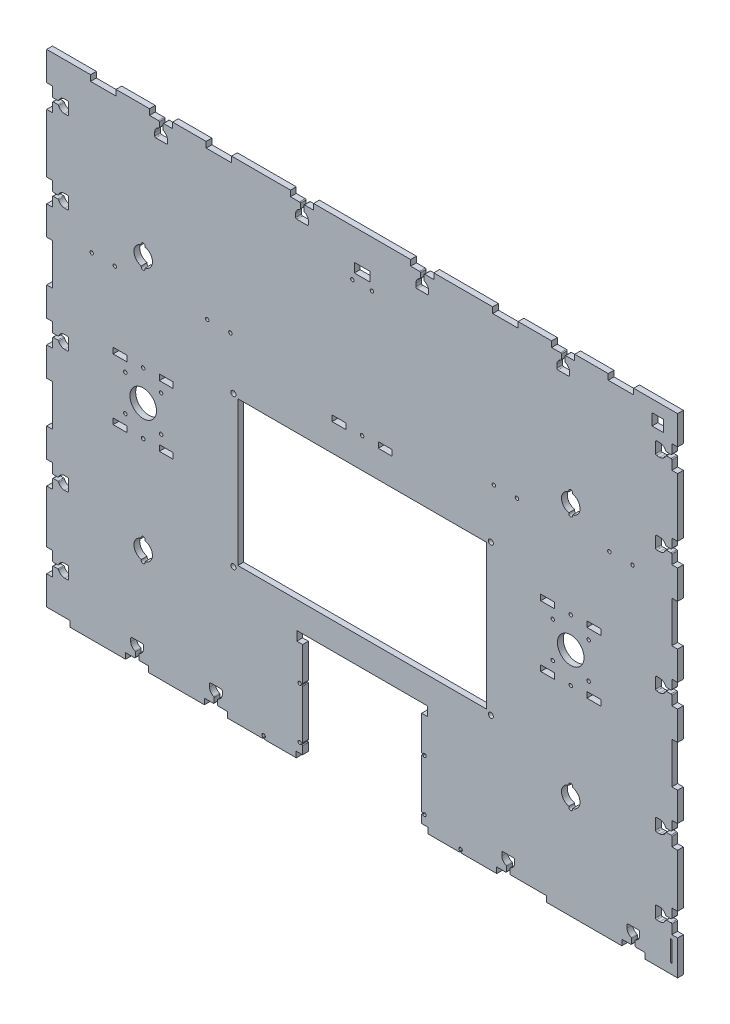
from build123d import *

# Parameters (mm, degrees)
MODEL_W             = 12
MODEL_H             = 5
MODEL_R             = 1.5
MODEL_R_2           = 11.5
MODEL_R_3           = 2.2
MODEL_W_2           = 215.000007986
MODEL_H_2           = 125.000004643
MODEL_W_3           = 1
MODEL_H_3           = 18
MODEL_R_4           = 1.500000056
MODEL_W_4           = 13.5
MODEL_H_4           = 8
MODEL_W_5           = 10
MODEL_H_5           = 10
BOSS_EXTRUDE1_DEPTH = 5


with BuildPart() as part:
    # Model → Boss-Extrude1 (new body)
    with BuildSketch(Plane.XY):
        with BuildLine():
            Line((273, -206.5), (273, -181.5))
            Line((273, -181.5), (268, -181.5))
            Line((268, -181.5), (268, -173.750193612))
            add(Edge.make_bspline(
                [(268, -173.750193612), (267.999999791, -173.33590955), (267.664103162, -173.000094081), (267.249819112, -173.000193984)],
                knots=[2, 2, 2, 2, 3, 3, 3, 3], degree=3))
            Line((267.249819112, -173.000193984), (263.325100614, -173.001131645))
            add(Edge.make_bspline(
                [(263.325100614, -173.001131645), (263.017403971, -173.001648847), (262.74197184, -173.190589935), (262.631021085, -173.477587185)],
                knots=[4, 4, 4, 4, 5, 5, 5, 5], degree=3))
            add(Edge.make_bspline(
                [(262.631021085, -173.477587185), (261.832378718, -175.533441231), (259.82894886, -177.000461264), (257.499713701, -177.0000075)],
                knots=[5, 5, 5, 5, 6, 6, 6, 6], degree=3))
            Line((257.499713701, -177.0000075), (254.900040672, -177.0000075))
            add(Edge.make_bspline(
                [(254.900040672, -177.0000075), (254.347755901, -177.0000075), (253.900040634, -176.552292233), (253.900040634, -176.000007463)],
                knots=[7, 7, 7, 7, 8, 8, 8, 8], degree=3))
            Line((253.900040634, -176.000007463), (253.900040634, -167.000007129))
            add(Edge.make_bspline(
                [(253.900040634, -167.000007129), (253.900040634, -166.447722359), (254.347755901, -166.000007092), (254.900040672, -166.000007092)],
                knots=[9, 9, 9, 9, 10, 10, 10, 10], degree=3))
            Line((254.900040672, -166.000007092), (257.499713701, -166.000007092))
            add(Edge.make_bspline(
                [(257.499713701, -166.000007092), (259.829246715, -165.99952966), (261.832905972, -167.466904671), (262.631363118, -169.52316413)],
                knots=[11, 11, 11, 11, 12, 12, 12, 12], degree=3))
            add(Edge.make_bspline(
                [(262.631363118, -169.52316413), (262.742284754, -169.810282086), (263.017801928, -169.999315929), (263.325600725, -169.999796089)],
                knots=[12, 12, 12, 12, 13, 13, 13, 13], degree=3))
            Line((263.325600725, -169.999796089), (267.249966202, -169.999974932))
            add(Edge.make_bspline(
                [(267.249966202, -169.999974932), (267.664192974, -169.999993583), (268.000000009, -169.664201661), (268, -169.249974888)],
                knots=[14, 14, 14, 14, 15, 15, 15, 15], degree=3))
            Line((268, -169.249974888), (268, -161.5))
            Line((268, -161.5), (273, -161.5))
            Line((273, -161.5), (273, -115.75))
            Line((273, -115.75), (268, -115.75))
            Line((268, -115.75), (268, -108.000193612))
            add(Edge.make_bspline(
                [(268, -108.000193612), (267.999999791, -107.58590955), (267.664103162, -107.250094081), (267.249819112, -107.250193984)],
                knots=[20, 20, 20, 20, 21, 21, 21, 21], degree=3))
            Line((267.249819112, -107.250193984), (263.325100614, -107.25113141))
            add(Edge.make_bspline(
                [(263.325100614, -107.25113141), (263.017403971, -107.251648613), (262.74197184, -107.4405897), (262.631021085, -107.727586951)],
                knots=[22, 22, 22, 22, 23, 23, 23, 23], degree=3))
            add(Edge.make_bspline(
                [(262.631021085, -107.727586951), (261.832378718, -109.783440997), (259.82894886, -111.25046103), (257.499713701, -111.250007266)],
                knots=[23, 23, 23, 23, 24, 24, 24, 24], degree=3))
            Line((257.499713701, -111.250007266), (254.900040672, -111.250007266))
            add(Edge.make_bspline(
                [(254.900040672, -111.250007266), (254.347755901, -111.250007266), (253.900040634, -110.802291999), (253.900040634, -110.250007228)],
                knots=[25, 25, 25, 25, 26, 26, 26, 26], degree=3))
            Line((253.900040634, -110.250007228), (253.900040634, -101.250006895))
            add(Edge.make_bspline(
                [(253.900040634, -101.250006895), (253.900040634, -100.697722124), (254.347755901, -100.250006858), (254.900040672, -100.250006858)],
                knots=[27, 27, 27, 27, 28, 28, 28, 28], degree=3))
            Line((254.900040672, -100.250006858), (257.499713701, -100.250006858))
            add(Edge.make_bspline(
                [(257.499713701, -100.250006858), (259.829246715, -100.249529425), (261.832905972, -101.716904437), (262.631363118, -103.773163896)],
                knots=[29, 29, 29, 29, 30, 30, 30, 30], degree=3))
            add(Edge.make_bspline(
                [(262.631363118, -103.773163896), (262.742284754, -104.060281852), (263.017801928, -104.249315695), (263.325600725, -104.249795854)],
                knots=[30, 30, 30, 30, 31, 31, 31, 31], degree=3))
            Line((263.325600725, -104.249795854), (267.249966202, -104.249974932))
            add(Edge.make_bspline(
                [(267.249966202, -104.249974932), (267.664192974, -104.249993583), (268.000000009, -103.914201661), (268, -103.499974888)],
                knots=[32, 32, 32, 32, 33, 33, 33, 33], degree=3))
            Line((268, -103.499974888), (268, -95.75))
            Line((268, -95.75), (273, -95.75))
            Line((273, -95.75), (273, -70.75))
            Line((273, -70.75), (268, -70.75))
            Line((268, -70.75), (268, -35))
            Line((268, -35), (273, -35))
            Line((273, -35), (273, -10))
            Line((273, -10), (268, -10))
            Line((268, -10), (268, -2.250193612))
            add(Edge.make_bspline(
                [(268, -2.250193612), (267.999999792, -1.83590955), (267.664103164, -1.50009408), (267.249819114, -1.500193983)],
                knots=[42, 42, 42, 42, 43, 43, 43, 43], degree=3))
            Line((267.249819114, -1.500193983), (263.325100614, -1.501124582))
            add(Edge.make_bspline(
                [(263.325100614, -1.501124582), (263.017403971, -1.501641784), (262.74197184, -1.690582872), (262.631021085, -1.977580122)],
                knots=[44, 44, 44, 44, 45, 45, 45, 45], degree=3))
            add(Edge.make_bspline(
                [(262.631021085, -1.977580122), (261.832378718, -4.033434168), (259.82894886, -5.500454201), (257.499713701, -5.500000437)],
                knots=[45, 45, 45, 45, 46, 46, 46, 46], degree=3))
            Line((257.499713701, -5.500000437), (254.900040672, -5.500000437))
            add(Edge.make_bspline(
                [(254.900040672, -5.500000437), (254.347755901, -5.500000437), (253.900040634, -5.05228517), (253.900040634, -4.5000004)],
                knots=[47, 47, 47, 47, 48, 48, 48, 48], degree=3))
            Line((253.900040634, -4.5000004), (253.900040634, 4.499999934))
            add(Edge.make_bspline(
                [(253.900040634, 4.499999934), (253.900039798, 5.052284704), (254.347754387, 5.500000649), (254.900039158, 5.500001485)],
                knots=[49, 49, 49, 49, 50, 50, 50, 50], degree=3))
            Line((254.900039158, 5.500001485), (257.499712187, 5.500001485))
            add(Edge.make_bspline(
                [(257.499712187, 5.500001485), (259.829245201, 5.500478917), (261.832904458, 4.033103906), (262.631361604, 1.976844447)],
                knots=[51, 51, 51, 51, 52, 52, 52, 52], degree=3))
            add(Edge.make_bspline(
                [(262.631361604, 1.976844447), (262.74228324, 1.689726491), (263.017800414, 1.500692648), (263.325599211, 1.500212488)],
                knots=[52, 52, 52, 52, 53, 53, 53, 53], degree=3))
            Line((263.325599211, 1.500212488), (267.249964688, 1.500026582))
            add(Edge.make_bspline(
                [(267.249964688, 1.500026582), (267.66419146, 1.500007095), (267.999999173, 1.835798339), (268, 2.250025112)],
                knots=[54, 54, 54, 54, 55, 55, 55, 55], degree=3))
            Line((268, 2.250025112), (268, 10))
            Line((268, 10), (273, 10))
            Line((273, 10), (273, 35))
            Line((273, 35), (268, 35))
            Line((268, 35), (268, 70.75))
            Line((268, 70.75), (273, 70.75))
            Line((273, 70.75), (273, 95.75))
            Line((273, 95.75), (268, 95.75))
            Line((268, 95.75), (268, 103.499806388))
            add(Edge.make_bspline(
                [(268, 103.499806388), (267.999999792, 103.91409045), (267.664103164, 104.24990592), (267.249819114, 104.249806017)],
                knots=[64, 64, 64, 64, 65, 65, 65, 65], degree=3))
            Line((267.249819114, 104.249806017), (263.325100614, 104.248875687))
            add(Edge.make_bspline(
                [(263.325100614, 104.248875687), (263.017403971, 104.248358484), (262.74197184, 104.059417397), (262.631021085, 103.772420146)],
                knots=[66, 66, 66, 66, 67, 67, 67, 67], degree=3))
            add(Edge.make_bspline(
                [(262.631021085, 103.772420146), (261.832378718, 101.7165661), (259.82894886, 100.249546068), (257.499713701, 100.249999831)],
                knots=[67, 67, 67, 67, 68, 68, 68, 68], degree=3))
            Line((257.499713701, 100.249999831), (254.900040672, 100.249999831))
            add(Edge.make_bspline(
                [(254.900040672, 100.249999831), (254.347755901, 100.249999831), (253.900040634, 100.697715098), (253.900040634, 101.249999869)],
                knots=[69, 69, 69, 69, 70, 70, 70, 70], degree=3))
            Line((253.900040634, 101.249999869), (253.900040634, 110.250000202))
            add(Edge.make_bspline(
                [(253.900040634, 110.250000202), (253.900039798, 110.802284973), (254.347754387, 111.250000917), (254.900039158, 111.250001753)],
                knots=[71, 71, 71, 71, 72, 72, 72, 72], degree=3))
            Line((254.900039158, 111.250001753), (257.499712187, 111.250001753))
            add(Edge.make_bspline(
                [(257.499712187, 111.250001753), (259.829245201, 111.250479186), (261.832904458, 109.783104174), (262.631361604, 107.726844715)],
                knots=[73, 73, 73, 73, 74, 74, 74, 74], degree=3))
            add(Edge.make_bspline(
                [(262.631361604, 107.726844715), (262.74228324, 107.439726759), (263.017800414, 107.250692916), (263.325599211, 107.250212757)],
                knots=[74, 74, 74, 74, 75, 75, 75, 75], degree=3))
            Line((263.325599211, 107.250212757), (267.249964688, 107.250026582))
            add(Edge.make_bspline(
                [(267.249964688, 107.250026582), (267.66419146, 107.250007095), (267.999999173, 107.585798339), (268, 108.000025112)],
                knots=[76, 76, 76, 76, 77, 77, 77, 77], degree=3))
            Line((268, 108.000025112), (268, 115.75))
            Line((268, 115.75), (273, 115.75))
            Line((273, 115.75), (273, 166.5))
            Line((273, 166.5), (268, 166.5))
            Line((268, 166.5), (268, 174.249806388))
            add(Edge.make_bspline(
                [(268, 174.249806388), (267.999999819, 174.66409045), (267.664103212, 174.999905941), (267.249819162, 174.999806065)],
                knots=[3, 3, 3, 3, 4, 4, 4, 4], degree=3))
            Line((267.249819162, 174.999806065), (263.325100614, 174.999106171))
            add(Edge.make_bspline(
                [(263.325100614, 174.999106171), (263.017403971, 174.998588968), (262.74197184, 174.809647881), (262.631021085, 174.522650631)],
                knots=[5, 5, 5, 5, 6, 6, 6, 6], degree=3))
            add(Edge.make_bspline(
                [(262.631021085, 174.522650631), (261.832378718, 172.466796585), (259.82894886, 170.999776552), (257.499713701, 171.000230316)],
                knots=[6, 6, 6, 6, 7, 7, 7, 7], degree=3))
            Line((257.499713701, 171.000230316), (254.900040672, 171.000230316))
            add(Edge.make_bspline(
                [(254.900040672, 171.000230316), (254.347755901, 171.000230316), (253.900040634, 171.447945583), (253.900040634, 172.000230353)],
                knots=[8, 8, 8, 8, 9, 9, 9, 9], degree=3))
            Line((253.900040634, 172.000230353), (253.900040634, 181.000230687))
            add(Edge.make_bspline(
                [(253.900040634, 181.000230687), (253.900040634, 181.552515457), (254.347755901, 182.000230724), (254.900040672, 182.000230724)],
                knots=[10, 10, 10, 10, 11, 11, 11, 11], degree=3))
            Line((254.900040672, 182.000230724), (257.499713701, 182.000230724))
            add(Edge.make_bspline(
                [(257.499713701, 182.000230724), (259.829246715, 182.000708156), (261.832905972, 180.533333145), (262.631363118, 178.477073686)],
                knots=[12, 12, 12, 12, 13, 13, 13, 13], degree=3))
            add(Edge.make_bspline(
                [(262.631363118, 178.477073686), (262.742284754, 178.18995573), (263.017801928, 178.000921887), (263.325600725, 178.000441727)],
                knots=[13, 13, 13, 13, 14, 14, 14, 14], degree=3))
            Line((263.325600725, 178.000441727), (267.249966184, 178.000025086))
            add(Edge.make_bspline(
                [(267.249966184, 178.000025086), (267.664192956, 178.000006425), (267.999999999, 178.335798339), (268, 178.750025112)],
                knots=[15, 15, 15, 15, 16, 16, 16, 16], degree=3))
            Line((268, 178.750025112), (268, 186.5))
            Line((268, 186.5), (273, 186.5))
            Line((273, 186.5), (273, 211.5))
            Line((273, 211.5), (235, 211.5))
            Line((235, 211.5), (235, 206.5))
            Line((235, 206.5), (213, 206.5))
            Line((213, 206.5), (213, 211.5))
            Line((213, 211.5), (184, 211.5))
            Line((184, 211.5), (184, 206.5))
            Line((184, 206.5), (176.250193612, 206.5))
            add(Edge.make_bspline(
                [(176.250193612, 206.5), (175.83590955, 206.499999787), (175.500094085, 206.164103154), (175.500193992, 205.749819104)],
                knots=[7, 7, 7, 7, 8, 8, 8, 8], degree=3))
            Line((175.500193992, 205.749819104), (175.501090351, 201.825100596))
            add(Edge.make_bspline(
                [(175.501090351, 201.825100596), (175.501607554, 201.517403953), (175.690548641, 201.241971822), (175.977545891, 201.131021068)],
                knots=[9, 9, 9, 9, 10, 10, 10, 10], degree=3))
            add(Edge.make_bspline(
                [(175.977545891, 201.131021068), (178.033399938, 200.332378701), (179.500419971, 198.328948843), (179.499966207, 195.999713684)],
                knots=[10, 10, 10, 10, 11, 11, 11, 11], degree=3))
            Line((179.499966207, 195.999713684), (179.499966207, 193.400040655))
            add(Edge.make_bspline(
                [(179.499966207, 193.400040655), (179.499966207, 192.847755884), (179.052250941, 192.400040617), (178.49996617, 192.400040617)],
                knots=[12, 12, 12, 12, 13, 13, 13, 13], degree=3))
            Line((178.49996617, 192.400040617), (169.499965836, 192.400040617))
            add(Edge.make_bspline(
                [(169.499965836, 192.400040617), (168.947681066, 192.400040617), (168.499965799, 192.847755884), (168.499965799, 193.400040654)],
                knots=[14, 14, 14, 14, 15, 15, 15, 15], degree=3))
            Line((168.499965799, 193.400040654), (168.499965799, 195.999713684))
            add(Edge.make_bspline(
                [(168.499965799, 195.999713684), (168.499488367, 198.329246698), (169.966863378, 200.332905955), (172.023122837, 201.131363101)],
                knots=[16, 16, 16, 16, 17, 17, 17, 17], degree=3))
            add(Edge.make_bspline(
                [(172.023122837, 201.131363101), (172.310240792, 201.242284737), (172.499274635, 201.517801911), (172.499754795, 201.825600708)],
                knots=[17, 17, 17, 17, 18, 18, 18, 18], degree=3))
            Line((172.499754795, 201.825600708), (172.499974913, 205.749966183))
            add(Edge.make_bspline(
                [(172.499974913, 205.749966183), (172.499993575, 206.164192955), (172.164201661, 206.499999999), (171.749974888, 206.5)],
                knots=[19, 19, 19, 19, 20, 20, 20, 20], degree=3))
            Line((171.749974888, 206.5), (164, 206.5))
            Line((164, 206.5), (164, 211.5))
            Line((164, 211.5), (135, 211.5))
            Line((135, 211.5), (135, 206.5))
            Line((135, 206.5), (113, 206.5))
            Line((113, 206.5), (113, 211.5))
            Line((113, 211.5), (62, 211.5))
            Line((62, 211.5), (62, 206.5))
            Line((62, 206.5), (54.250193612, 206.5))
            add(Edge.make_bspline(
                [(54.250193612, 206.5), (53.83590955, 206.499999787), (53.500094084, 206.164103155), (53.500193991, 205.749819105)],
                knots=[29, 29, 29, 29, 30, 30, 30, 30], degree=3))
            Line((53.500193991, 205.749819105), (53.50108663, 201.825100596))
            add(Edge.make_bspline(
                [(53.50108663, 201.825100596), (53.501603833, 201.517403953), (53.69054492, 201.241971822), (53.97754217, 201.131021068)],
                knots=[31, 31, 31, 31, 32, 32, 32, 32], degree=3))
            add(Edge.make_bspline(
                [(53.97754217, 201.131021068), (56.033396216, 200.332378701), (57.50041625, 198.328948843), (57.499962486, 195.999713684)],
                knots=[32, 32, 32, 32, 33, 33, 33, 33], degree=3))
            Line((57.499962486, 195.999713684), (57.499962486, 193.400040655))
            add(Edge.make_bspline(
                [(57.499962486, 193.400040655), (57.499962486, 192.847755884), (57.05224722, 192.400040617), (56.499962449, 192.400040617)],
                knots=[34, 34, 34, 34, 35, 35, 35, 35], degree=3))
            Line((56.499962449, 192.400040617), (47.499962115, 192.400040617))
            add(Edge.make_bspline(
                [(47.499962115, 192.400040617), (46.947677345, 192.400040617), (46.499962078, 192.847755884), (46.499962078, 193.400040654)],
                knots=[36, 36, 36, 36, 37, 37, 37, 37], degree=3))
            Line((46.499962078, 193.400040654), (46.499962078, 195.999713684))
            add(Edge.make_bspline(
                [(46.499962078, 195.999713684), (46.499484646, 198.329246698), (47.966859657, 200.332905955), (50.023119116, 201.131363101)],
                knots=[38, 38, 38, 38, 39, 39, 39, 39], degree=3))
            add(Edge.make_bspline(
                [(50.023119116, 201.131363101), (50.310237071, 201.242284737), (50.499270914, 201.517801911), (50.499751074, 201.825600708)],
                knots=[39, 39, 39, 39, 40, 40, 40, 40], degree=3))
            Line((50.499751074, 201.825600708), (50.499974913, 205.749966183))
            add(Edge.make_bspline(
                [(50.499974913, 205.749966183), (50.499993575, 206.164192955), (50.164201661, 206.499999999), (49.749974888, 206.5)],
                knots=[41, 41, 41, 41, 42, 42, 42, 42], degree=3))
            Line((49.749974888, 206.5), (42, 206.5))
            Line((42, 206.5), (42, 211.5))
            Line((42, 211.5), (-42, 211.5))
            Line((-42, 211.5), (-42, 206.5))
            Line((-42, 206.5), (-49.749806388, 206.5))
            add(Edge.make_bspline(
                [(-49.749806388, 206.5), (-50.16409045, 206.499999781), (-50.49990591, 206.164103143), (-50.499805997, 205.749819093)],
                knots=[47, 47, 47, 47, 48, 48, 48, 48], degree=3))
            Line((-50.499805997, 205.749819093), (-50.498862092, 201.825100596))
            add(Edge.make_bspline(
                [(-50.498862092, 201.825100596), (-50.498344889, 201.517403953), (-50.309403802, 201.241971822), (-50.022406552, 201.131021068)],
                knots=[49, 49, 49, 49, 50, 50, 50, 50], degree=3))
            add(Edge.make_bspline(
                [(-50.022406552, 201.131021068), (-47.966552506, 200.332378701), (-46.499532472, 198.328948843), (-46.499986236, 195.999713684)],
                knots=[50, 50, 50, 50, 51, 51, 51, 51], degree=3))
            Line((-46.499986236, 195.999713684), (-46.499986236, 193.400040655))
            add(Edge.make_bspline(
                [(-46.499986236, 193.400040655), (-46.499986236, 192.847755884), (-46.947701503, 192.400040617), (-47.499986273, 192.400040617)],
                knots=[52, 52, 52, 52, 53, 53, 53, 53], degree=3))
            Line((-47.499986273, 192.400040617), (-56.499986607, 192.400040617))
            add(Edge.make_bspline(
                [(-56.499986607, 192.400040617), (-57.052271377, 192.400040617), (-57.499986644, 192.847755884), (-57.499986644, 193.400040654)],
                knots=[54, 54, 54, 54, 55, 55, 55, 55], degree=3))
            Line((-57.499986644, 193.400040654), (-57.499986644, 195.999713684))
            add(Edge.make_bspline(
                [(-57.499986644, 195.999713684), (-57.500464077, 198.329246698), (-56.033089066, 200.332905955), (-53.976829606, 201.131363101)],
                knots=[56, 56, 56, 56, 57, 57, 57, 57], degree=3))
            add(Edge.make_bspline(
                [(-53.976829606, 201.131363101), (-53.689711651, 201.242284737), (-53.500677808, 201.517801911), (-53.500197648, 201.825600708)],
                knots=[57, 57, 57, 57, 58, 58, 58, 58], degree=3))
            Line((-53.500197648, 201.825600708), (-53.500025085, 205.749966186))
            add(Edge.make_bspline(
                [(-53.500025085, 205.749966186), (-53.500006424, 206.164192957), (-53.835798339, 206.5), (-54.250025112, 206.5)],
                knots=[59, 59, 59, 59, 60, 60, 60, 60], degree=3))
            Line((-54.250025112, 206.5), (-62, 206.5))
            Line((-62, 206.5), (-62, 211.5))
            Line((-62, 211.5), (-113, 211.5))
            Line((-113, 211.5), (-113, 206.5))
            Line((-113, 206.5), (-135, 206.5))
            Line((-135, 206.5), (-135, 211.5))
            Line((-135, 211.5), (-164, 211.5))
            Line((-164, 211.5), (-164, 206.5))
            Line((-164, 206.5), (-171.749806388, 206.5))
            add(Edge.make_bspline(
                [(-171.749806388, 206.5), (-172.16409045, 206.499999781), (-172.499905911, 206.164103144), (-172.499805998, 205.749819094)],
                knots=[69, 69, 69, 69, 70, 70, 70, 70], degree=3))
            Line((-172.499805998, 205.749819094), (-172.498866318, 201.825100596))
            add(Edge.make_bspline(
                [(-172.498866318, 201.825100596), (-172.498349115, 201.517403953), (-172.309408028, 201.241971822), (-172.022410777, 201.131021068)],
                knots=[71, 71, 71, 71, 72, 72, 72, 72], degree=3))
            add(Edge.make_bspline(
                [(-172.022410777, 201.131021068), (-169.966556731, 200.332378701), (-168.499536698, 198.328948843), (-168.499990462, 195.999713684)],
                knots=[72, 72, 72, 72, 73, 73, 73, 73], degree=3))
            Line((-168.499990462, 195.999713684), (-168.499990462, 193.400040655))
            add(Edge.make_bspline(
                [(-168.499990462, 193.400040655), (-168.499990461, 192.847755884), (-168.947705728, 192.400040617), (-169.499990499, 192.400040617)],
                knots=[74, 74, 74, 74, 75, 75, 75, 75], degree=3))
            Line((-169.499990499, 192.400040617), (-178.499990832, 192.400040617))
            add(Edge.make_bspline(
                [(-178.499990832, 192.400040617), (-179.052275603, 192.400040617), (-179.49999087, 192.847755884), (-179.49999087, 193.400040654)],
                knots=[76, 76, 76, 76, 77, 77, 77, 77], degree=3))
            Line((-179.49999087, 193.400040654), (-179.49999087, 195.999713684))
            add(Edge.make_bspline(
                [(-179.49999087, 195.999713684), (-179.500468302, 198.329246698), (-178.033093291, 200.332905955), (-175.976833832, 201.131363101)],
                knots=[78, 78, 78, 78, 79, 79, 79, 79], degree=3))
            add(Edge.make_bspline(
                [(-175.976833832, 201.131363101), (-175.689715876, 201.242284737), (-175.500682033, 201.517801911), (-175.500201874, 201.825600708)],
                knots=[79, 79, 79, 79, 80, 80, 80, 80], degree=3))
            Line((-175.500201874, 201.825600708), (-175.500025085, 205.749966185))
            add(Edge.make_bspline(
                [(-175.500025085, 205.749966185), (-175.500006424, 206.164192957), (-175.835798339, 206.5), (-176.250025112, 206.5)],
                knots=[81, 81, 81, 81, 82, 82, 82, 82], degree=3))
            Line((-176.250025112, 206.5), (-184, 206.5))
            Line((-184, 206.5), (-184, 211.5))
            Line((-184, 211.5), (-213, 211.5))
            Line((-213, 211.5), (-213, 206.5))
            Line((-213, 206.5), (-235, 206.5))
            Line((-235, 206.5), (-235, 211.5))
            Line((-235, 211.5), (-273, 211.5))
            Line((-273, 211.5), (-273, 186.5))
            Line((-273, 186.5), (-268, 186.5))
            Line((-268, 186.5), (-268, 178.750025112))
            add(Edge.make_bspline(
                [(-268, 178.750025112), (-267.999989318, 178.33579834), (-267.664173615, 178.000015084), (-267.249946844, 178.000044427)],
                knots=[4, 4, 4, 4, 5, 5, 5, 5], degree=3))
            Line((-267.249946844, 178.000044427), (-263.325581383, 178.000441728))
            add(Edge.make_bspline(
                [(-263.325581383, 178.000441728), (-263.017782586, 178.000921887), (-262.742265412, 178.18995573), (-262.631343776, 178.477073686)],
                knots=[6, 6, 6, 6, 7, 7, 7, 7], degree=3))
            add(Edge.make_bspline(
                [(-262.631343776, 178.477073686), (-261.83288663, 180.533333145), (-259.829227373, 182.000708156), (-257.499694359, 182.000230724)],
                knots=[7, 7, 7, 7, 8, 8, 8, 8], degree=3))
            Line((-257.499694359, 182.000230724), (-254.90002133, 182.000230724))
            add(Edge.make_bspline(
                [(-254.90002133, 182.000230724), (-254.347736559, 182.000230724), (-253.900021292, 181.552515457), (-253.900021292, 181.000230687)],
                knots=[9, 9, 9, 9, 10, 10, 10, 10], degree=3))
            Line((-253.900021292, 181.000230687), (-253.900021292, 172.000230353))
            add(Edge.make_bspline(
                [(-253.900021292, 172.000230353), (-253.900021292, 171.447945583), (-254.347736559, 171.000230316), (-254.90002133, 171.000230316)],
                knots=[11, 11, 11, 11, 12, 12, 12, 12], degree=3))
            Line((-254.90002133, 171.000230316), (-257.499694359, 171.000230316))
            add(Edge.make_bspline(
                [(-257.499694359, 171.000230316), (-259.828929518, 170.999776552), (-261.832359376, 172.466796585), (-262.631001743, 174.522650631)],
                knots=[13, 13, 13, 13, 14, 14, 14, 14], degree=3))
            add(Edge.make_bspline(
                [(-262.631001743, 174.522650631), (-262.741952498, 174.809647882), (-263.017384629, 174.998588969), (-263.325081272, 174.999106172)],
                knots=[14, 14, 14, 14, 15, 15, 15, 15], degree=3))
            Line((-263.325081272, 174.999106172), (-267.249799823, 174.999786721))
            add(Edge.make_bspline(
                [(-267.249799823, 174.999786721), (-267.66408387, 174.99989728), (-267.999989136, 174.66409045), (-268, 174.249806388)],
                knots=[16, 16, 16, 16, 17, 17, 17, 17], degree=3))
            Line((-268, 174.249806388), (-268, 166.5))
            Line((-268, 166.5), (-273, 166.5))
            Line((-273, 166.5), (-273, 115.75))
            Line((-273, 115.75), (-268, 115.75))
            Line((-268, 115.75), (-268, 108.000193612))
            add(Edge.make_bspline(
                [(-268, 108.000193612), (-267.999995704, 107.58590955), (-267.664095762, 107.250097395), (-267.249811713, 107.250201386)],
                knots=[22, 22, 22, 22, 23, 23, 23, 23], degree=3))
            Line((-267.249811713, 107.250201386), (-263.325093211, 107.251125897))
            add(Edge.make_bspline(
                [(-263.325093211, 107.251125897), (-263.017396568, 107.2516431), (-262.741964437, 107.440584187), (-262.631013683, 107.727581438)],
                knots=[24, 24, 24, 24, 25, 25, 25, 25], degree=3))
            add(Edge.make_bspline(
                [(-262.631013683, 107.727581438), (-261.832371316, 109.783435484), (-259.828941458, 111.250455517), (-257.499706299, 111.250001753)],
                knots=[25, 25, 25, 25, 26, 26, 26, 26], degree=3))
            Line((-257.499706299, 111.250001753), (-254.900033269, 111.250001753))
            add(Edge.make_bspline(
                [(-254.900033269, 111.250001753), (-254.347748499, 111.250001753), (-253.900033232, 110.802286487), (-253.900033232, 110.250001716)],
                knots=[27, 27, 27, 27, 28, 28, 28, 28], degree=3))
            Line((-253.900033232, 110.250001716), (-253.900033232, 101.250001382))
            add(Edge.make_bspline(
                [(-253.900033232, 101.250001382), (-253.900032396, 100.697716612), (-254.347746985, 100.250000667), (-254.900031755, 100.249999831)],
                knots=[29, 29, 29, 29, 30, 30, 30, 30], degree=3))
            Line((-254.900031755, 100.249999831), (-257.499704785, 100.249999831))
            add(Edge.make_bspline(
                [(-257.499704785, 100.249999831), (-259.829237799, 100.249522399), (-261.832897056, 101.71689741), (-262.631354201, 103.773156869)],
                knots=[31, 31, 31, 31, 32, 32, 32, 32], degree=3))
            add(Edge.make_bspline(
                [(-262.631354201, 103.773156869), (-262.742275837, 104.060274825), (-263.017793012, 104.249308668), (-263.325591809, 104.249788827)],
                knots=[32, 32, 32, 32, 33, 33, 33, 33], degree=3))
            Line((-263.325591809, 104.249788827), (-267.249957286, 104.249966015))
            add(Edge.make_bspline(
                [(-267.249957286, 104.249966015), (-267.664184058, 104.249989591), (-267.999995085, 103.914201661), (-268, 103.499974888)],
                knots=[34, 34, 34, 34, 35, 35, 35, 35], degree=3))
            Line((-268, 103.499974888), (-268, 95.75))
            Line((-268, 95.75), (-273, 95.75))
            Line((-273, 95.75), (-273, 70.75))
            Line((-273, 70.75), (-268, 70.75))
            Line((-268, 70.75), (-268, 35))
            Line((-268, 35), (-273, 35))
            Line((-273, 35), (-273, 10))
            Line((-273, 10), (-268, 10))
            Line((-268, 10), (-268, 2.250193612))
            add(Edge.make_bspline(
                [(-268, 2.250193612), (-267.999995704, 1.83590955), (-267.664095762, 1.500097395), (-267.249811713, 1.500201386)],
                knots=[44, 44, 44, 44, 45, 45, 45, 45], degree=3))
            Line((-267.249811713, 1.500201386), (-263.325093211, 1.501125629))
            add(Edge.make_bspline(
                [(-263.325093211, 1.501125629), (-263.017396568, 1.501642832), (-262.741964437, 1.690583919), (-262.631013683, 1.977581169)],
                knots=[46, 46, 46, 46, 47, 47, 47, 47], degree=3))
            add(Edge.make_bspline(
                [(-262.631013683, 1.977581169), (-261.832371316, 4.033435215), (-259.828941458, 5.500455249), (-257.499706299, 5.500001485)],
                knots=[47, 47, 47, 47, 48, 48, 48, 48], degree=3))
            Line((-257.499706299, 5.500001485), (-254.900033269, 5.500001485))
            add(Edge.make_bspline(
                [(-254.900033269, 5.500001485), (-254.347748499, 5.500001485), (-253.900033232, 5.052286218), (-253.900033232, 4.500001448)],
                knots=[49, 49, 49, 49, 50, 50, 50, 50], degree=3))
            Line((-253.900033232, 4.500001448), (-253.900033232, -4.499998886))
            add(Edge.make_bspline(
                [(-253.900033232, -4.499998886), (-253.900032396, -5.052283656), (-254.347746985, -5.499999601), (-254.900031755, -5.500000437)],
                knots=[51, 51, 51, 51, 52, 52, 52, 52], degree=3))
            Line((-254.900031755, -5.500000437), (-257.499704785, -5.500000437))
            add(Edge.make_bspline(
                [(-257.499704785, -5.500000437), (-259.829237799, -5.50047787), (-261.832897056, -4.033102858), (-262.631354201, -1.976843399)],
                knots=[53, 53, 53, 53, 54, 54, 54, 54], degree=3))
            add(Edge.make_bspline(
                [(-262.631354201, -1.976843399), (-262.742275837, -1.689725444), (-263.017793012, -1.500691601), (-263.325591809, -1.500211441)],
                knots=[54, 54, 54, 54, 55, 55, 55, 55], degree=3))
            Line((-263.325591809, -1.500211441), (-267.249957286, -1.500033985))
            add(Edge.make_bspline(
                [(-267.249957286, -1.500033985), (-267.664184058, -1.500010409), (-267.999995085, -1.835798339), (-268, -2.250025112)],
                knots=[56, 56, 56, 56, 57, 57, 57, 57], degree=3))
            Line((-268, -2.250025112), (-268, -10))
            Line((-268, -10), (-273, -10))
            Line((-273, -10), (-273, -35))
            Line((-273, -35), (-268, -35))
            Line((-268, -35), (-268, -70.75))
            Line((-268, -70.75), (-273, -70.75))
            Line((-273, -70.75), (-273, -95.75))
            Line((-273, -95.75), (-268, -95.75))
            Line((-268, -95.75), (-268, -103.499806388))
            add(Edge.make_bspline(
                [(-268, -103.499806388), (-267.999995705, -103.91409045), (-267.664095764, -104.249902606), (-267.249811715, -104.249798616)],
                knots=[66, 66, 66, 66, 67, 67, 67, 67], degree=3))
            Line((-267.249811715, -104.249798616), (-263.325093211, -104.248882714))
            add(Edge.make_bspline(
                [(-263.325093211, -104.248882714), (-263.017396568, -104.248365511), (-262.741964437, -104.059424424), (-262.631013683, -103.772427173)],
                knots=[68, 68, 68, 68, 69, 69, 69, 69], degree=3))
            add(Edge.make_bspline(
                [(-262.631013683, -103.772427173), (-261.832371316, -101.716573127), (-259.828941458, -100.249553094), (-257.499706299, -100.250006858)],
                knots=[69, 69, 69, 69, 70, 70, 70, 70], degree=3))
            Line((-257.499706299, -100.250006858), (-254.900033269, -100.250006858))
            add(Edge.make_bspline(
                [(-254.900033269, -100.250006858), (-254.347748499, -100.250006858), (-253.900033232, -100.697722124), (-253.900033232, -101.250006895)],
                knots=[71, 71, 71, 71, 72, 72, 72, 72], degree=3))
            Line((-253.900033232, -101.250006895), (-253.900033232, -110.250007229))
            add(Edge.make_bspline(
                [(-253.900033232, -110.250007229), (-253.900033232, -110.802291999), (-254.347748499, -111.250007266), (-254.900033269, -111.250007266)],
                knots=[73, 73, 73, 73, 74, 74, 74, 74], degree=3))
            Line((-254.900033269, -111.250007266), (-257.499706299, -111.250007266))
            add(Edge.make_bspline(
                [(-257.499706299, -111.250007266), (-259.829239313, -111.250484698), (-261.83289857, -109.783109687), (-262.631355715, -107.726850228)],
                knots=[75, 75, 75, 75, 76, 76, 76, 76], degree=3))
            add(Edge.make_bspline(
                [(-262.631355715, -107.726850228), (-262.742277351, -107.439732272), (-263.017794526, -107.250698429), (-263.325593323, -107.25021827)],
                knots=[76, 76, 76, 76, 77, 77, 77, 77], degree=3))
            Line((-263.325593323, -107.25021827), (-267.2499588, -107.250032471))
            add(Edge.make_bspline(
                [(-267.2499588, -107.250032471), (-267.664185571, -107.250009731), (-267.999995921, -107.585798339), (-268, -108.000025112)],
                knots=[78, 78, 78, 78, 79, 79, 79, 79], degree=3))
            Line((-268, -108.000025112), (-268, -115.75))
            Line((-268, -115.75), (-273, -115.75))
            Line((-273, -115.75), (-273, -161.5))
            Line((-273, -161.5), (-268, -161.5))
            Line((-268, -161.5), (-268, -169.249806388))
            add(Edge.make_bspline(
                [(-268, -169.249806388), (-267.999999793, -169.66409045), (-267.664103165, -169.99990592), (-267.249819115, -169.999806019)],
                knots=[84, 84, 84, 84, 85, 85, 85, 85], degree=3))
            Line((-267.249819115, -169.999806019), (-263.325100614, -169.998882948))
            add(Edge.make_bspline(
                [(-263.325100614, -169.998882948), (-263.017403971, -169.998365745), (-262.74197184, -169.809424658), (-262.631021085, -169.522427408)],
                knots=[86, 86, 86, 86, 87, 87, 87, 87], degree=3))
            add(Edge.make_bspline(
                [(-262.631021085, -169.522427408), (-261.832378718, -167.466573362), (-259.82894886, -165.999553328), (-257.499713701, -166.000007092)],
                knots=[87, 87, 87, 87, 88, 88, 88, 88], degree=3))
            Line((-257.499713701, -166.000007092), (-254.900040672, -166.000007092))
            add(Edge.make_bspline(
                [(-254.900040672, -166.000007092), (-254.347755901, -166.000007092), (-253.900040634, -166.447722359), (-253.900040634, -167.000007129)],
                knots=[89, 89, 89, 89, 90, 90, 90, 90], degree=3))
            Line((-253.900040634, -167.000007129), (-253.900040634, -176.000007463))
            add(Edge.make_bspline(
                [(-253.900040634, -176.000007463), (-253.900040634, -176.552292233), (-254.347755901, -177.0000075), (-254.900040672, -177.0000075)],
                knots=[91, 91, 91, 91, 92, 92, 92, 92], degree=3))
            Line((-254.900040672, -177.0000075), (-257.499713701, -177.0000075))
            add(Edge.make_bspline(
                [(-257.499713701, -177.0000075), (-259.829246715, -177.000484933), (-261.832905972, -175.533109921), (-262.631363118, -173.476850462)],
                knots=[93, 93, 93, 93, 94, 94, 94, 94], degree=3))
            add(Edge.make_bspline(
                [(-262.631363118, -173.476850462), (-262.742284754, -173.189732507), (-263.017801928, -173.000698664), (-263.325600725, -173.000218504)],
                knots=[94, 94, 94, 94, 95, 95, 95, 95], degree=3))
            Line((-263.325600725, -173.000218504), (-267.249966202, -173.000025069))
            add(Edge.make_bspline(
                [(-267.249966202, -173.000025069), (-267.664192973, -173.000006417), (-268.000000009, -173.335798339), (-268, -173.750025112)],
                knots=[96, 96, 96, 96, 97, 97, 97, 97], degree=3))
            Line((-268, -173.750025112), (-268, -181.5))
            Line((-268, -181.5), (-273, -181.5))
            Line((-273, -181.5), (-273, -206.5))
            Line((-273, -206.5), (-253, -206.5))
            Line((-253, -206.5), (-253, -211.5))
            Line((-253, -211.5), (-204.75, -211.5))
            Line((-204.75, -211.5), (-204.75, -206.5))
            Line((-204.75, -206.5), (-197.000193612, -206.5))
            add(Edge.make_bspline(
                [(-197.000193612, -206.5), (-196.58590955, -206.49999978), (-196.25009409, -206.164103143), (-196.250194004, -205.749819093)],
                knots=[2, 2, 2, 2, 3, 3, 3, 3], degree=3))
            Line((-196.250194004, -205.749819093), (-196.251141975, -201.825100597))
            add(Edge.make_bspline(
                [(-196.251141975, -201.825100597), (-196.251659178, -201.517403954), (-196.440600265, -201.241971823), (-196.727597515, -201.131021068)],
                knots=[4, 4, 4, 4, 5, 5, 5, 5], degree=3))
            add(Edge.make_bspline(
                [(-196.727597515, -201.131021068), (-198.783451561, -200.332378701), (-200.250471594, -198.328948843), (-200.250017831, -195.999713684)],
                knots=[5, 5, 5, 5, 6, 6, 6, 6], degree=3))
            Line((-200.250017831, -195.999713684), (-200.250017831, -193.400040655))
            add(Edge.make_bspline(
                [(-200.250017831, -193.400040655), (-200.250017831, -192.847755884), (-199.802302564, -192.400040617), (-199.250017793, -192.400040617)],
                knots=[7, 7, 7, 7, 8, 8, 8, 8], degree=3))
            Line((-199.250017793, -192.400040617), (-190.25001746, -192.400040617))
            add(Edge.make_bspline(
                [(-190.25001746, -192.400040617), (-189.697732689, -192.400040617), (-189.250017422, -192.847755884), (-189.250017422, -193.400040655)],
                knots=[9, 9, 9, 9, 10, 10, 10, 10], degree=3))
            Line((-189.250017422, -193.400040655), (-189.250017422, -195.999713684))
            add(Edge.make_bspline(
                [(-189.250017422, -195.999713684), (-189.24953999, -198.329246698), (-190.716915001, -200.332905955), (-192.77317446, -201.131363101)],
                knots=[11, 11, 11, 11, 12, 12, 12, 12], degree=3))
            add(Edge.make_bspline(
                [(-192.77317446, -201.131363101), (-193.060292416, -201.242284737), (-193.249326259, -201.517801911), (-193.249806419, -201.825600708)],
                knots=[12, 12, 12, 12, 13, 13, 13, 13], degree=3))
            Line((-193.249806419, -201.825600708), (-193.249974916, -205.749966186))
            add(Edge.make_bspline(
                [(-193.249974916, -205.749966186), (-193.249993576, -206.164192958), (-192.914201661, -206.5), (-192.499974888, -206.5)],
                knots=[14, 14, 14, 14, 15, 15, 15, 15], degree=3))
            Line((-192.499974888, -206.5), (-184.75, -206.5))
            Line((-184.75, -206.5), (-184.75, -211.5))
            Line((-184.75, -211.5), (-136.5, -211.5))
            Line((-136.5, -211.5), (-136.5, -206.5))
            Line((-136.5, -206.5), (-128.750193612, -206.5))
            add(Edge.make_bspline(
                [(-128.750193612, -206.5), (-128.33590955, -206.499999781), (-128.000094089, -206.164103144), (-128.000194002, -205.749819094)],
                knots=[20, 20, 20, 20, 21, 21, 21, 21], degree=3))
            Line((-128.000194002, -205.749819094), (-128.001135311, -201.825100597))
            add(Edge.make_bspline(
                [(-128.001135311, -201.825100597), (-128.001652513, -201.517403954), (-128.190593601, -201.241971823), (-128.477590851, -201.131021068)],
                knots=[22, 22, 22, 22, 23, 23, 23, 23], degree=3))
            add(Edge.make_bspline(
                [(-128.477590851, -201.131021068), (-130.533444897, -200.332378701), (-132.00046493, -198.328948843), (-132.000011166, -195.999713684)],
                knots=[23, 23, 23, 23, 24, 24, 24, 24], degree=3))
            Line((-132.000011166, -195.999713684), (-132.000011166, -193.400040655))
            add(Edge.make_bspline(
                [(-132.000011166, -193.400040655), (-132.000011166, -192.847755884), (-131.552295899, -192.400040617), (-131.000011129, -192.400040617)],
                knots=[25, 25, 25, 25, 26, 26, 26, 26], degree=3))
            Line((-131.000011129, -192.400040617), (-122.000010795, -192.400040617))
            add(Edge.make_bspline(
                [(-122.000010795, -192.400040617), (-121.447726025, -192.400040617), (-121.000010758, -192.847755884), (-121.000010758, -193.400040655)],
                knots=[27, 27, 27, 27, 28, 28, 28, 28], degree=3))
            Line((-121.000010758, -193.400040655), (-121.000010758, -195.999713684))
            add(Edge.make_bspline(
                [(-121.000010758, -195.999713684), (-120.999533326, -198.329246698), (-122.466908337, -200.332905955), (-124.523167796, -201.131363101)],
                knots=[29, 29, 29, 29, 30, 30, 30, 30], degree=3))
            add(Edge.make_bspline(
                [(-124.523167796, -201.131363101), (-124.810285752, -201.242284737), (-124.999319595, -201.517801911), (-124.999799755, -201.825600708)],
                knots=[30, 30, 30, 30, 31, 31, 31, 31], degree=3))
            Line((-124.999799755, -201.825600708), (-124.999974915, -205.749966185))
            add(Edge.make_bspline(
                [(-124.999974915, -205.749966185), (-124.999993576, -206.164192957), (-124.664201661, -206.5), (-124.249974888, -206.5)],
                knots=[32, 32, 32, 32, 33, 33, 33, 33], degree=3))
            Line((-124.249974888, -206.5), (-116.5, -206.5))
            Line((-116.5, -206.5), (-116.5, -211.5))
            Line((-116.5, -211.5), (-86.35094567, -211.5))
            add(Edge.make_bspline(
                [(-86.35094567, -211.5), (-85.995139508, -211.5), (-85.706561102, -211.211828138), (-85.706059496, -210.85602233)],
                knots=[36, 36, 36, 36, 37, 37, 37, 37], degree=3))
            Line((-85.706059496, -210.85602233), (-85.706002385, -210.814248339))
            add(Edge.make_bspline(
                [(-85.706002385, -210.814248339), (-85.705677099, -210.583512484), (-85.835750793, -210.381683929), (-86.028677555, -210.255120091)],
                knots=[38, 38, 38, 38, 39, 39, 39, 39], degree=3))
            add(Edge.make_bspline(
                [(-86.028677555, -210.255120091), (-86.437187477, -209.987129362), (-86.706969257, -209.525074084), (-86.706969257, -209.000007896)],
                knots=[39, 39, 39, 39, 40, 40, 40, 40], degree=3))
            add(Edge.make_bspline(
                [(-86.706969257, -209.000007896), (-86.706969256, -208.053014745), (-85.829406494, -207.310987359), (-84.843135407, -207.542786779)],
                knots=[40, 40, 40, 40, 41, 41, 41, 41], degree=3))
            add(Edge.make_bspline(
                [(-84.843135407, -207.542786779), (-84.318635236, -207.666057994), (-83.889732356, -208.084492755), (-83.756971061, -208.606671519)],
                knots=[41, 41, 41, 41, 42, 42, 42, 42], degree=3))
            add(Edge.make_bspline(
                [(-83.756971061, -208.606671519), (-83.583022527, -209.29084856), (-83.879398889, -209.926606059), (-84.391054073, -210.258901493)],
                knots=[42, 42, 42, 42, 43, 43, 43, 43], degree=3))
            add(Edge.make_bspline(
                [(-84.391054073, -210.258901493), (-84.580561133, -210.381977214), (-84.711013531, -210.577066407), (-84.71676923, -210.802958928)],
                knots=[43, 43, 43, 43, 44, 44, 44, 44], degree=3))
            Line((-84.71676923, -210.802958928), (-84.717677996, -210.83868692))
            add(Edge.make_bspline(
                [(-84.717677996, -210.83868692), (-84.72691382, -211.201163034), (-84.435594175, -211.5), (-84.073000417, -211.5)],
                knots=[45, 45, 45, 45, 46, 46, 46, 46], degree=3))
            Line((-84.073000417, -211.5), (-57, -211.5))
            Line((-57, -211.5), (-57, -206.5))
            Line((-57, -206.5), (-51.5, -206.5))
            Line((-51.5, -206.5), (-51.5, -199.664204794))
            add(Edge.make_bspline(
                [(-51.5, -199.664204794), (-51.5, -199.308398632), (-51.788171862, -199.019820226), (-52.14397767, -199.01931862)],
                knots=[1, 1, 1, 1, 2, 2, 2, 2], degree=3))
            Line((-52.14397767, -199.01931862), (-52.185751659, -199.019259728))
            add(Edge.make_bspline(
                [(-52.185751659, -199.019259728), (-52.416487514, -199.018934442), (-52.618316069, -199.149008136), (-52.744879907, -199.341934898)],
                knots=[3, 3, 3, 3, 4, 4, 4, 4], degree=3))
            add(Edge.make_bspline(
                [(-52.744879907, -199.341934898), (-53.012870636, -199.75044482), (-53.474925913, -200.0202266), (-53.999992101, -200.0202266)],
                knots=[4, 4, 4, 4, 5, 5, 5, 5], degree=3))
            add(Edge.make_bspline(
                [(-53.999992101, -200.0202266), (-54.946985253, -200.020226648), (-55.689012683, -199.142663924), (-55.457213315, -198.156392825)],
                knots=[5, 5, 5, 5, 6, 6, 6, 6], degree=3))
            add(Edge.make_bspline(
                [(-55.457213315, -198.156392825), (-55.333942035, -197.631892669), (-54.915507221, -197.20298984), (-54.393328441, -197.070228609)],
                knots=[6, 6, 6, 6, 7, 7, 7, 7], degree=3))
            add(Edge.make_bspline(
                [(-54.393328441, -197.070228609), (-53.7091514, -196.896280076), (-53.0733939, -197.192656438), (-52.741098467, -197.704311621)],
                knots=[7, 7, 7, 7, 8, 8, 8, 8], degree=3))
            add(Edge.make_bspline(
                [(-52.741098467, -197.704311621), (-52.618022746, -197.893818681), (-52.422933553, -198.024271079), (-52.197041032, -198.030026779)],
                knots=[8, 8, 8, 8, 9, 9, 9, 9], degree=3))
            Line((-52.197041032, -198.030026779), (-52.16131308, -198.03093712))
            add(Edge.make_bspline(
                [(-52.16131308, -198.03093712), (-51.798836966, -198.040172944), (-51.5, -197.748853299), (-51.5, -197.38625954)],
                knots=[10, 10, 10, 10, 11, 11, 11, 11], degree=3))
            Line((-51.5, -197.38625954), (-51.5, -155.304836585))
            add(Edge.make_bspline(
                [(-51.5, -155.304836585), (-51.5, -154.949030423), (-51.788171862, -154.660452016), (-52.14397767, -154.65995041)],
                knots=[12, 12, 12, 12, 13, 13, 13, 13], degree=3))
            Line((-52.14397767, -154.65995041), (-52.185751659, -154.659891518))
            add(Edge.make_bspline(
                [(-52.185751659, -154.659891518), (-52.416487514, -154.659566232), (-52.618316069, -154.789639927), (-52.744879907, -154.982566688)],
                knots=[14, 14, 14, 14, 15, 15, 15, 15], degree=3))
            add(Edge.make_bspline(
                [(-52.744879907, -154.982566688), (-53.012870636, -155.391076611), (-53.474925913, -155.66085839), (-53.999992101, -155.66085839)],
                knots=[15, 15, 15, 15, 16, 16, 16, 16], degree=3))
            add(Edge.make_bspline(
                [(-53.999992101, -155.66085839), (-54.946985253, -155.660858438), (-55.689012683, -154.783295715), (-55.457213315, -153.797024616)],
                knots=[16, 16, 16, 16, 17, 17, 17, 17], degree=3))
            add(Edge.make_bspline(
                [(-55.457213315, -153.797024616), (-55.333942035, -153.272524459), (-54.915507221, -152.843621631), (-54.393328441, -152.7108604)],
                knots=[17, 17, 17, 17, 18, 18, 18, 18], degree=3))
            add(Edge.make_bspline(
                [(-54.393328441, -152.7108604), (-53.7091514, -152.536911866), (-53.0733939, -152.833288228), (-52.741098467, -153.344943411)],
                knots=[18, 18, 18, 18, 19, 19, 19, 19], degree=3))
            add(Edge.make_bspline(
                [(-52.741098467, -153.344943411), (-52.618022746, -153.534450471), (-52.422933553, -153.66490287), (-52.197041032, -153.670658569)],
                knots=[19, 19, 19, 19, 20, 20, 20, 20], degree=3))
            Line((-52.197041032, -153.670658569), (-52.16131308, -153.671568911))
            add(Edge.make_bspline(
                [(-52.16131308, -153.671568911), (-51.798836966, -153.680804734), (-51.5, -153.389485089), (-51.5, -153.026891331)],
                knots=[21, 21, 21, 21, 22, 22, 22, 22], degree=3))
            Line((-51.5, -153.026891331), (-51.5, -123.8))
            Line((-51.5, -123.8), (-56.5, -123.8))
            Line((-56.5, -123.8), (-56.5, -115.8))
            Line((-56.5, -115.8), (56.5, -115.8))
            Line((56.5, -115.8), (56.5, -123.8))
            Line((56.5, -123.8), (51.5, -123.8))
            Line((51.5, -123.8), (51.5, -153.044440734))
            add(Edge.make_bspline(
                [(52.14397767, -153.689326908), (51.788171862, -153.688825302), (51.5, -153.400246896), (51.5, -153.044440734)],
                knots=[21, 21, 21, 21, 22, 22, 22, 22], degree=3))
            Line((52.14397767, -153.689326908), (52.185751659, -153.6893858))
            add(Edge.make_bspline(
                [(52.744879907, -153.36671063), (52.618316069, -153.559637392), (52.416487514, -153.689711086), (52.185751659, -153.6893858)],
                knots=[19, 19, 19, 19, 20, 20, 20, 20], degree=3))
            add(Edge.make_bspline(
                [(53.999992101, -152.688418929), (53.474925913, -152.688418929), (53.012870636, -152.958200708), (52.744879907, -153.36671063)],
                knots=[18, 18, 18, 18, 19, 19, 19, 19], degree=3))
            add(Edge.make_bspline(
                [(55.457213315, -154.552252703), (55.689012683, -153.565981604), (54.946985253, -152.68841888), (53.999992101, -152.688418929)],
                knots=[17, 17, 17, 17, 18, 18, 18, 18], degree=3))
            add(Edge.make_bspline(
                [(54.393328441, -155.638416919), (54.915507221, -155.505655688), (55.333942035, -155.076752859), (55.457213315, -154.552252703)],
                knots=[16, 16, 16, 16, 17, 17, 17, 17], degree=3))
            add(Edge.make_bspline(
                [(52.741098467, -155.004333907), (53.0733939, -155.51598909), (53.7091514, -155.812365452), (54.393328441, -155.638416919)],
                knots=[15, 15, 15, 15, 16, 16, 16, 16], degree=3))
            add(Edge.make_bspline(
                [(52.197041032, -154.678618749), (52.422933553, -154.684374449), (52.618022746, -154.814826847), (52.741098467, -155.004333907)],
                knots=[14, 14, 14, 14, 15, 15, 15, 15], degree=3))
            Line((52.197041032, -154.678618749), (52.16131308, -154.677708408))
            add(Edge.make_bspline(
                [(51.5, -155.322385988), (51.5, -154.959792229), (51.798836966, -154.668472584), (52.16131308, -154.677708408)],
                knots=[12, 12, 12, 12, 13, 13, 13, 13], degree=3))
            Line((51.5, -155.322385988), (51.5, -197.403808944))
            add(Edge.make_bspline(
                [(52.14397767, -198.048695118), (51.788171862, -198.048193512), (51.5, -197.759615106), (51.5, -197.403808944)],
                knots=[10, 10, 10, 10, 11, 11, 11, 11], degree=3))
            Line((52.14397767, -198.048695118), (52.185751659, -198.04875401))
            add(Edge.make_bspline(
                [(52.744879907, -197.72607884), (52.618316069, -197.919005602), (52.416487514, -198.049079296), (52.185751659, -198.04875401)],
                knots=[8, 8, 8, 8, 9, 9, 9, 9], degree=3))
            add(Edge.make_bspline(
                [(53.999992101, -197.047787138), (53.474925913, -197.047787138), (53.012870636, -197.317568918), (52.744879907, -197.72607884)],
                knots=[7, 7, 7, 7, 8, 8, 8, 8], degree=3))
            add(Edge.make_bspline(
                [(55.457213315, -198.911620913), (55.689012683, -197.925349814), (54.946985253, -197.04778709), (53.999992101, -197.047787138)],
                knots=[6, 6, 6, 6, 7, 7, 7, 7], degree=3))
            add(Edge.make_bspline(
                [(54.393328441, -199.997785129), (54.915507221, -199.865023898), (55.333942035, -199.436121069), (55.457213315, -198.911620913)],
                knots=[5, 5, 5, 5, 6, 6, 6, 6], degree=3))
            add(Edge.make_bspline(
                [(52.741098467, -199.363702117), (53.0733939, -199.8753573), (53.7091514, -200.171733662), (54.393328441, -199.997785129)],
                knots=[4, 4, 4, 4, 5, 5, 5, 5], degree=3))
            add(Edge.make_bspline(
                [(52.197041032, -199.037986959), (52.422933553, -199.043742658), (52.618022746, -199.174195057), (52.741098467, -199.363702117)],
                knots=[3, 3, 3, 3, 4, 4, 4, 4], degree=3))
            Line((52.197041032, -199.037986959), (52.16131308, -199.037076618))
            add(Edge.make_bspline(
                [(51.5, -199.681754197), (51.5, -199.319160439), (51.798836966, -199.027840794), (52.16131308, -199.037076618)],
                knots=[1, 1, 1, 1, 2, 2, 2, 2], degree=3))
            Line((51.5, -199.681754197), (51.5, -206.5))
            Line((51.5, -206.5), (57, -206.5))
            Line((57, -206.5), (57, -211.5))
            Line((57, -211.5), (84.123910229, -211.5))
            add(Edge.make_bspline(
                [(84.768796403, -210.85602233), (84.768294797, -211.211828138), (84.479716391, -211.5), (84.123910229, -211.5)],
                knots=[10, 10, 10, 10, 11, 11, 11, 11], degree=3))
            Line((84.768796403, -210.85602233), (84.768855295, -210.814248341))
            add(Edge.make_bspline(
                [(84.446180125, -210.255120093), (84.639106887, -210.381683931), (84.769180581, -210.583512486), (84.768855295, -210.814248341)],
                knots=[8, 8, 8, 8, 9, 9, 9, 9], degree=3))
            add(Edge.make_bspline(
                [(83.767888424, -209.000007899), (83.767888424, -209.525074087), (84.037670203, -209.987129364), (84.446180125, -210.255120093)],
                knots=[7, 7, 7, 7, 8, 8, 8, 8], degree=3))
            add(Edge.make_bspline(
                [(85.631722198, -207.542786685), (84.645451099, -207.310987317), (83.767888375, -208.053014747), (83.767888424, -209.000007899)],
                knots=[6, 6, 6, 6, 7, 7, 7, 7], degree=3))
            add(Edge.make_bspline(
                [(86.717886414, -208.606671559), (86.585125183, -208.084492779), (86.156222355, -207.666057965), (85.631722198, -207.542786685)],
                knots=[5, 5, 5, 5, 6, 6, 6, 6], degree=3))
            add(Edge.make_bspline(
                [(86.083803402, -210.258901533), (86.595458585, -209.9266061), (86.891834947, -209.2908486), (86.717886414, -208.606671559)],
                knots=[4, 4, 4, 4, 5, 5, 5, 5], degree=3))
            add(Edge.make_bspline(
                [(85.758088244, -210.802958968), (85.763843944, -210.577066447), (85.894296342, -210.381977254), (86.083803402, -210.258901533)],
                knots=[3, 3, 3, 3, 4, 4, 4, 4], degree=3))
            Line((85.758088244, -210.802958968), (85.757177903, -210.83868692))
            add(Edge.make_bspline(
                [(86.401855483, -211.5), (86.039261724, -211.5), (85.747942079, -211.201163034), (85.757177903, -210.83868692)],
                knots=[1, 1, 1, 1, 2, 2, 2, 2], degree=3))
            Line((86.401855483, -211.5), (116.5, -211.5))
            Line((116.5, -211.5), (116.5, -206.5))
            Line((116.5, -206.5), (124.249806388, -206.5))
            add(Edge.make_bspline(
                [(124.249806388, -206.5), (124.66409045, -206.499999783), (124.999905912, -206.164103148), (124.999806001, -205.749819098)],
                knots=[2, 2, 2, 2, 3, 3, 3, 3], degree=3))
            Line((124.999806001, -205.749819098), (124.998880615, -201.825100597))
            add(Edge.make_bspline(
                [(124.998880615, -201.825100597), (124.998363412, -201.517403954), (124.809422325, -201.241971823), (124.522425074, -201.131021068)],
                knots=[4, 4, 4, 4, 5, 5, 5, 5], degree=3))
            add(Edge.make_bspline(
                [(124.522425074, -201.131021068), (122.466571028, -200.332378701), (120.999550995, -198.328948843), (121.000004759, -195.999713684)],
                knots=[5, 5, 5, 5, 6, 6, 6, 6], degree=3))
            Line((121.000004759, -195.999713684), (121.000004759, -193.400040655))
            add(Edge.make_bspline(
                [(121.000004759, -193.400040655), (121.000004759, -192.847755884), (121.447720026, -192.400040617), (122.000004796, -192.400040617)],
                knots=[7, 7, 7, 7, 8, 8, 8, 8], degree=3))
            Line((122.000004796, -192.400040617), (131.00000513, -192.400040617))
            add(Edge.make_bspline(
                [(131.00000513, -192.400040617), (131.5522899, -192.400040617), (132.000005167, -192.847755884), (132.000005167, -193.400040655)],
                knots=[9, 9, 9, 9, 10, 10, 10, 10], degree=3))
            Line((132.000005167, -193.400040655), (132.000005167, -195.999713684))
            add(Edge.make_bspline(
                [(132.000005167, -195.999713684), (132.000482599, -198.329246698), (130.533107588, -200.332905955), (128.476848129, -201.131363101)],
                knots=[11, 11, 11, 11, 12, 12, 12, 12], degree=3))
            add(Edge.make_bspline(
                [(128.476848129, -201.131363101), (128.189730173, -201.242284737), (128.00069633, -201.517801911), (128.00021617, -201.825600708)],
                knots=[12, 12, 12, 12, 13, 13, 13, 13], degree=3))
            Line((128.00021617, -201.825600708), (128.000047724, -205.749966186))
            add(Edge.make_bspline(
                [(128.000047724, -205.749966186), (128.000029063, -206.164192958), (128.335820979, -206.5), (128.750047751, -206.5)],
                knots=[14, 14, 14, 14, 15, 15, 15, 15], degree=3))
            Line((128.750047751, -206.5), (159.75, -206.5))
            Line((159.75, -206.5), (159.75, -211.5))
            Line((159.75, -211.5), (224.75, -211.5))
            Line((224.75, -211.5), (224.75, -206.5))
            Line((224.75, -206.5), (232.499806388, -206.5))
            add(Edge.make_bspline(
                [(233.249806001, -205.749819098), (233.249905912, -206.164103148), (232.91409045, -206.499999783), (232.499806388, -206.5)],
                knots=[16, 16, 16, 16, 17, 17, 17, 17], degree=3))
            Line((233.249806001, -205.749819098), (233.248880625, -201.825100597))
            add(Edge.make_bspline(
                [(232.772425084, -201.131021068), (233.059422335, -201.241971823), (233.248363422, -201.517403954), (233.248880625, -201.825100597)],
                knots=[14, 14, 14, 14, 15, 15, 15, 15], degree=3))
            add(Edge.make_bspline(
                [(229.250004769, -195.999713684), (229.249551005, -198.328948843), (230.716571038, -200.332378701), (232.772425084, -201.131021068)],
                knots=[13, 13, 13, 13, 14, 14, 14, 14], degree=3))
            Line((229.250004769, -195.999713684), (229.250004769, -193.400040655))
            add(Edge.make_bspline(
                [(230.250004806, -192.400040617), (229.697720036, -192.400040617), (229.250004769, -192.847755884), (229.250004769, -193.400040655)],
                knots=[11, 11, 11, 11, 12, 12, 12, 12], degree=3))
            Line((230.250004806, -192.400040617), (239.25000514, -192.400040617))
            add(Edge.make_bspline(
                [(240.250005177, -193.400040655), (240.250005177, -192.847755884), (239.80228991, -192.400040617), (239.25000514, -192.400040617)],
                knots=[9, 9, 9, 9, 10, 10, 10, 10], degree=3))
            Line((240.250005177, -193.400040655), (240.250005177, -195.999713684))
            add(Edge.make_bspline(
                [(236.726848139, -201.131363101), (238.783107598, -200.332905955), (240.250482609, -198.329246698), (240.250005177, -195.999713684)],
                knots=[7, 7, 7, 7, 8, 8, 8, 8], degree=3))
            add(Edge.make_bspline(
                [(236.250216181, -201.825600708), (236.25069634, -201.517801911), (236.439730183, -201.242284737), (236.726848139, -201.131363101)],
                knots=[6, 6, 6, 6, 7, 7, 7, 7], degree=3))
            Line((236.250216181, -201.825600708), (236.250025085, -205.749966185))
            add(Edge.make_bspline(
                [(237.000025112, -206.5), (236.585798339, -206.5), (236.250006424, -206.164192957), (236.250025085, -205.749966185)],
                knots=[4, 4, 4, 4, 5, 5, 5, 5], degree=3))
            Line((237.000025112, -206.5), (244.75, -206.5))
            Line((244.75, -206.5), (244.75, -211.5))
            Line((244.75, -211.5), (273, -211.5))
            Line((273, -211.5), (273, -206.5))
        make_face()
        with BuildLine():
            ThreePointArc((-191.054174925, -129.838536364), (-197.455003993, -122), (-191.054174925, -114.161463636))
            ThreePointArc((-191.054174925, -114.161463636), (-189.455003993, -111.78972), (-187.855833061, -114.161463636))
            ThreePointArc((-187.855833061, -114.161463636), (-181.455003993, -122), (-187.855833061, -129.838536364))
            ThreePointArc((-187.855833061, -129.838536364), (-189.455003993, -132.21028), (-191.054174925, -129.838536364))
        make_face(mode=Mode.SUBTRACT)
        with Locations((-209.455003993, -38.5)):
            Rectangle(MODEL_W, MODEL_H, mode=Mode.SUBTRACT)
        with Locations((-204.955003993, -27.5)):
            Circle(MODEL_R, mode=Mode.SUBTRACT)
        with Locations((-189.455003993, -38.5)):
            Circle(MODEL_R, mode=Mode.SUBTRACT)
        with Locations((-173.955003993, -27.5)):
            Circle(MODEL_R, mode=Mode.SUBTRACT)
        with Locations((-169.455003993, -38.5)):
            Rectangle(MODEL_W, MODEL_H, mode=Mode.SUBTRACT)
        with Locations((-189.455003993, -12)):
            Circle(MODEL_R_2, mode=Mode.SUBTRACT)
        with Locations((-111.375, -95.368998174)):
            Circle(MODEL_R_3, mode=Mode.SUBTRACT)
        with Locations((0, -30.119000496)):
            Rectangle(MODEL_W_2, MODEL_H_2, mode=Mode.SUBTRACT)
        with Locations((267.5, -194)):
            Rectangle(MODEL_W_3, MODEL_H_3, mode=Mode.SUBTRACT)
        with BuildLine():
            ThreePointArc((182.144166939, -114.161463636), (188.544996007, -122), (182.144166939, -129.838536364))
            ThreePointArc((182.144166939, -129.838536364), (180.544996007, -132.21028), (178.945825075, -129.838536364))
            ThreePointArc((178.945825075, -129.838536364), (172.544996007, -122), (178.945825075, -114.161463636))
            ThreePointArc((178.945825075, -114.161463636), (180.544996007, -111.78972), (182.144166939, -114.161463636))
        make_face(mode=Mode.SUBTRACT)
        with Locations((111.375, -95.368998174)):
            Circle(MODEL_R_3, mode=Mode.SUBTRACT)
        with Locations((160.544996007, -38.5)):
            Rectangle(MODEL_W, MODEL_H, mode=Mode.SUBTRACT)
        with Locations((165.044996007, -27.5)):
            Circle(MODEL_R, mode=Mode.SUBTRACT)
        with Locations((180.544996007, -38.5)):
            Circle(MODEL_R, mode=Mode.SUBTRACT)
        with Locations((200.544996007, -38.5)):
            Rectangle(MODEL_W, MODEL_H, mode=Mode.SUBTRACT)
        with Locations((196.044996007, -27.5)):
            Circle(MODEL_R, mode=Mode.SUBTRACT)
        with Locations((180.544996007, -12)):
            Circle(MODEL_R_2, mode=Mode.SUBTRACT)
        with Locations((-204.955003993, 3.5)):
            Circle(MODEL_R, mode=Mode.SUBTRACT)
        with Locations((-209.455003993, 14.5)):
            Rectangle(MODEL_W, MODEL_H, mode=Mode.SUBTRACT)
        with Locations((-173.955003993, 3.5)):
            Circle(MODEL_R, mode=Mode.SUBTRACT)
        with Locations((-189.455003993, 14.5)):
            Circle(MODEL_R, mode=Mode.SUBTRACT)
        with Locations((-169.455003993, 14.5)):
            Rectangle(MODEL_W, MODEL_H, mode=Mode.SUBTRACT)
        with Locations((-234, 78.5)):
            Circle(MODEL_R_4, mode=Mode.SUBTRACT)
        with Locations((-214, 78.5)):
            Circle(MODEL_R_4, mode=Mode.SUBTRACT)
        with BuildLine():
            ThreePointArc((-191.054174925, 105.838536364), (-189.455003993, 108.21028), (-187.855833061, 105.838536364))
            ThreePointArc((-187.855833061, 105.838536364), (-181.455003993, 98), (-187.855833061, 90.161463636))
            ThreePointArc((-187.855833061, 90.161463636), (-189.455003993, 87.78972), (-191.054174925, 90.161463636))
            ThreePointArc((-191.054174925, 90.161463636), (-197.455003993, 98), (-191.054174925, 105.838536364))
        make_face(mode=Mode.SUBTRACT)
        with Locations((-111.375, 34.381001826)):
            Circle(MODEL_R_3, mode=Mode.SUBTRACT)
        with Locations((-134, 78.5)):
            Circle(MODEL_R_4, mode=Mode.SUBTRACT)
        with Locations((-114, 78.5)):
            Circle(MODEL_R_4, mode=Mode.SUBTRACT)
        with Locations((-20, 58.5)):
            Rectangle(MODEL_W, MODEL_H, mode=Mode.SUBTRACT)
        with Locations((0, 58.5)):
            Circle(MODEL_R, mode=Mode.SUBTRACT)
        with Locations((-8.5, 171.138)):
            Circle(MODEL_R, mode=Mode.SUBTRACT)
        with Locations((0, 181)):
            Rectangle(MODEL_W_4, MODEL_H_4, mode=Mode.SUBTRACT)
        with Locations((111.375, 34.381001826)):
            Circle(MODEL_R_3, mode=Mode.SUBTRACT)
        with Locations((20, 58.5)):
            Rectangle(MODEL_W, MODEL_H, mode=Mode.SUBTRACT)
        with Locations((114, 78.5)):
            Circle(MODEL_R_4, mode=Mode.SUBTRACT)
        with Locations((134, 78.5)):
            Circle(MODEL_R_4, mode=Mode.SUBTRACT)
        with Locations((165.044996007, 3.5)):
            Circle(MODEL_R, mode=Mode.SUBTRACT)
        with Locations((160.544996007, 14.5)):
            Rectangle(MODEL_W, MODEL_H, mode=Mode.SUBTRACT)
        with Locations((196.044996007, 3.5)):
            Circle(MODEL_R, mode=Mode.SUBTRACT)
        with Locations((180.544996007, 14.5)):
            Circle(MODEL_R, mode=Mode.SUBTRACT)
        with Locations((200.544996007, 14.5)):
            Rectangle(MODEL_W, MODEL_H, mode=Mode.SUBTRACT)
        with BuildLine():
            ThreePointArc((182.144166939, 105.838536364), (188.544996007, 98), (182.144166939, 90.161463636))
            ThreePointArc((182.144166939, 90.161463636), (180.544996007, 87.78972), (178.945825075, 90.161463636))
            ThreePointArc((178.945825075, 90.161463636), (172.544996007, 98), (178.945825075, 105.838536364))
            ThreePointArc((178.945825075, 105.838536364), (180.544996007, 108.21028), (182.144166939, 105.838536364))
        make_face(mode=Mode.SUBTRACT)
        with Locations((214, 78.5)):
            Circle(MODEL_R_4, mode=Mode.SUBTRACT)
        with Locations((234, 78.5)):
            Circle(MODEL_R_4, mode=Mode.SUBTRACT)
        with Locations((8.5, 171.138)):
            Circle(MODEL_R, mode=Mode.SUBTRACT)
        with Locations((255.9, 196.15)):
            Rectangle(MODEL_W_5, MODEL_H_5, mode=Mode.SUBTRACT)
    extrude(amount=BOSS_EXTRUDE1_DEPTH)


solid = part.part
